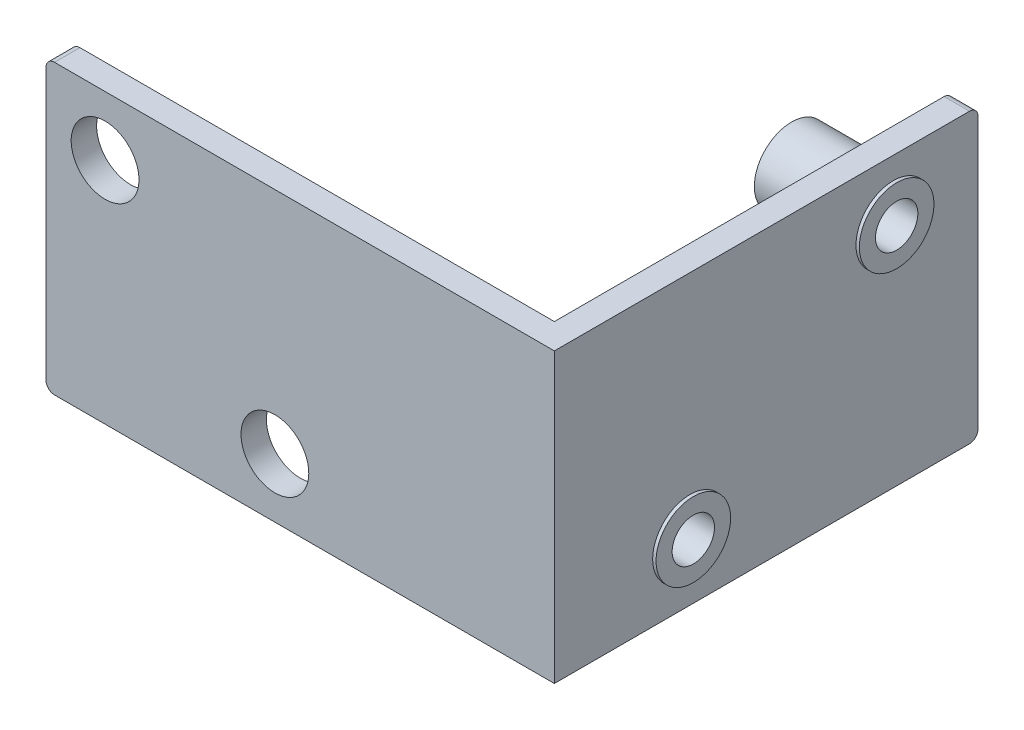
from build123d import *

# Parameters (mm, degrees)
ESQUISSE1_W             = 30
ESQUISSE1_H             = 17
EXTRUSION1_DEPTH        = 1.5
ESQUISSE2_R             = 2
ENL_V_MAT_EXTRU_1_DEPTH = 2
ESQUISSE3_W             = 1.5
ESQUISSE3_H             = 17
EXTRUSION2_DEPTH        = 23.5
ESQUISSE4_R             = 1.25
ENL_V_MAT_EXTRU_2_DEPTH = 2
EXTRUSION3_DEPTH        = 0.2
EXTRUSION3_DEPTH_BACK   = 6
ESQUISSE5_R             = 2.2
ESQUISSE5_R_2           = 1.25
CONG_1_R                = 0.5


with BuildPart() as part:
    # Esquisse1 → Extrusion1 (new body)
    with BuildSketch(Plane.XY):
        with Locations((6.051065449, -10.06674277)):
            Rectangle(ESQUISSE1_W, ESQUISSE1_H)
    extrude(amount=EXTRUSION1_DEPTH)

    # Esquisse2 → Enlèv. mat.-Extru.1 (cut)
    with BuildSketch(Plane.XY.offset(1.5)):
        with Locations((-5.463077382, -5.076163116)):
            Circle(ESQUISSE2_R)
        with Locations((4.558431294, -15.07006433)):
            Circle(ESQUISSE2_R)
    extrude(amount=-ENL_V_MAT_EXTRU_1_DEPTH, mode=Mode.SUBTRACT)

    # Esquisse3 → Extrusion2 (add)
    with BuildSketch(Plane(origin=(0, 0, 0), x_dir=(-1, 0, 0), z_dir=(0, 0, -1))):
        with Locations((-20.301065449, -10.06674277)):
            Rectangle(ESQUISSE3_W, ESQUISSE3_H)
    extrude(amount=EXTRUSION2_DEPTH)

    # Esquisse4 → Enlèv. mat.-Extru.2 (cut)
    with BuildSketch(Plane(origin=(21.051065449, 0, 0), x_dir=(0, 0, -1), z_dir=(1, 0, 0))):
        with Locations((6.5, -15.107440586)):
            Circle(ESQUISSE4_R)
        with Locations((18.5, -5.06674277)):
            Circle(ESQUISSE4_R)
    extrude(amount=-ENL_V_MAT_EXTRU_2_DEPTH, mode=Mode.SUBTRACT)

    # Esquisse5 → Extrusion3 (add, two sides: drawn at the far end of the back side and taken through both)
    # profile 1 of 2: a face of its own
    with BuildSketch(Plane(origin=(21.051065449, 0, 0), x_dir=(0, 0, -1), z_dir=(1, 0, 0)).offset(-EXTRUSION3_DEPTH_BACK)):
        with Locations((6.5, -15.107440586)):
            Circle(ESQUISSE5_R)
        with Locations((6.5, -15.107440586)):
            Circle(ESQUISSE5_R_2, mode=Mode.SUBTRACT)
    # profile 2 of 2: a face of its own
    with BuildSketch(Plane(origin=(21.051065449, 0, 0), x_dir=(0, 0, -1), z_dir=(1, 0, 0)).offset(-EXTRUSION3_DEPTH_BACK)):
        with Locations((18.5, -5.06674277)):
            Circle(ESQUISSE5_R)
        with Locations((18.5, -5.06674277)):
            Circle(ESQUISSE5_R_2, mode=Mode.SUBTRACT)
    extrude(amount=EXTRUSION3_DEPTH + EXTRUSION3_DEPTH_BACK)

    # Congé1
    cong_1_edges = [part.edges().sort_by_distance(p)[0] for p in [
        (20.301065449, -18.56674277, -23.5),
        (20.301065449, -1.56674277, -23.5),
        (-8.948934551, -18.56674277, 0.75),
        (-8.948934551, -1.56674277, 0.75),
    ]]
    fillet(cong_1_edges, radius=CONG_1_R)


solid = part.part
